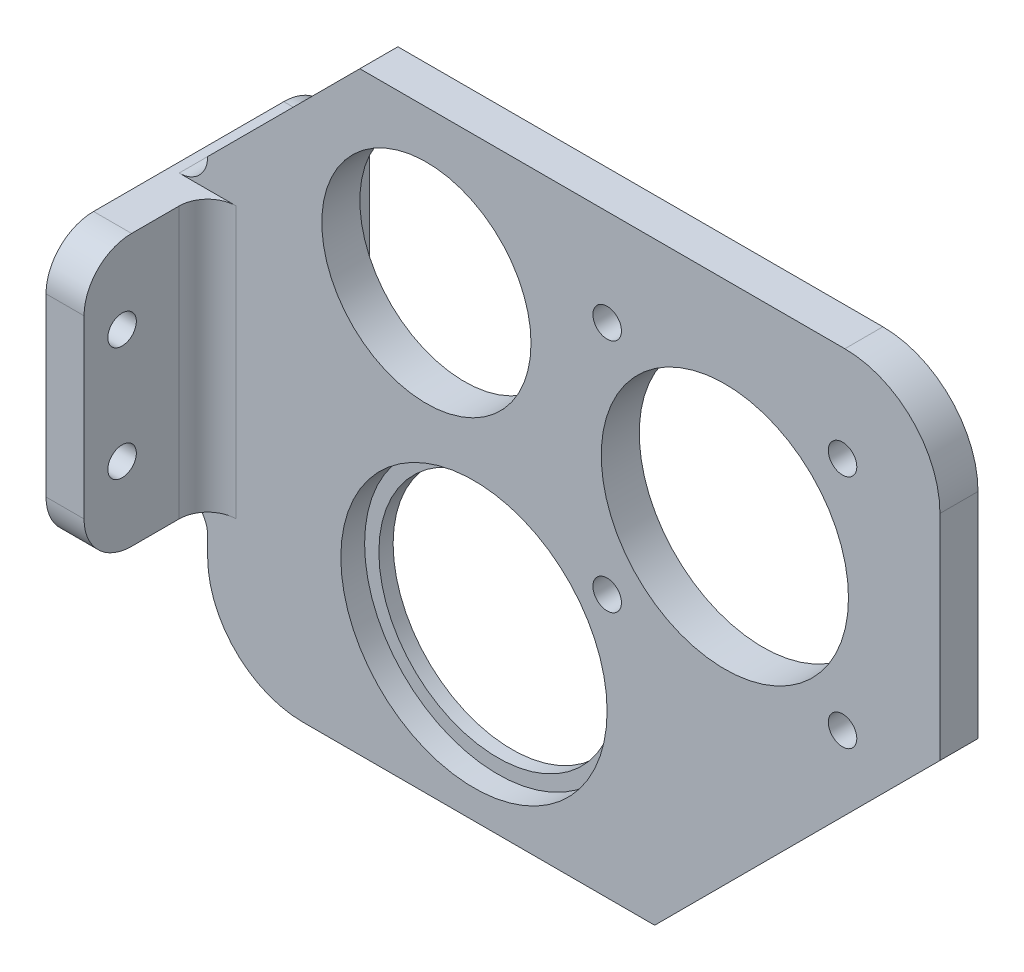
from build123d import *

# Parameters (mm, degrees)
SKETCH_1_W           = 77
SKETCH_1_H           = 62.5
SKETCH_1_R           = 14
SKETCH_1_R_2         = 13
EXTRUDE_1_DEPTH      = 4
EXTRUDE_2_DEPTH      = 17
EXTRUDE_2_DEPTH_BACK = 13
FILLET_1_R           = 3
SKETCH_4_W           = 20
SKETCH_4_H           = 28.5
CUT_EXTRUDE_3_DEPTH  = 74
SKETCH_9_R           = 1.5
CUT_EXTRUDE_6_DEPTH  = 10
SKETCH_10_R          = 1.5
CUT_EXTRUDE_7_DEPTH  = 10
FILLET_2_R           = 5
CUT_EXTRUDE_8_DEPTH  = 10
FILLET_3_R           = 10
FILLET_4_R           = 3
SKETCH_13_R          = 14
SKETCH_13_R_2        = 12.5
EXTRUDE_3_DEPTH      = 1.5
SKETCH_14_R          = 11
CUT_EXTRUDE_9_DEPTH  = 10


with BuildPart() as part:
    # 草图1 → 凸台-拉伸1 (new body)
    with BuildSketch(Plane.XY):
        with Locations((10.5, 14.25)):
            Rectangle(SKETCH_1_W, SKETCH_1_H)
        Circle(SKETCH_1_R, mode=Mode.SUBTRACT)
        with Locations((26.381811917, 23)):
            Circle(SKETCH_1_R_2, mode=Mode.SUBTRACT)
    extrude(amount=EXTRUDE_1_DEPTH)

    # 草图1<3> → 凸台-拉伸2 (add, two sides: drawn at the far end of the back side and taken through both)
    with BuildSketch(Plane.XY.offset(-EXTRUDE_2_DEPTH_BACK)):
        Polygon((-52, 22.5), (-52, 26.5), (-28, 26.5), (-28, -2), (-52, -2), (-52, 2), (-32, 2), (-32, 22.5), align=None)
    extrude(amount=EXTRUDE_2_DEPTH + EXTRUDE_2_DEPTH_BACK)

    # 圆角1
    fillet_1_edges = [part.edges().sort_by_distance(p)[0] for p in [
        (-28, 12.25, 0),
        (-28, 12.25, 4),
    ]]
    fillet(fillet_1_edges, radius=FILLET_1_R)

    # 草图4 → 切除-拉伸3 (cut)
    with BuildSketch(Plane.XY.offset(17)):
        with Locations((-42, 12.25)):
            Rectangle(SKETCH_4_W, SKETCH_4_H)
    extrude(amount=-CUT_EXTRUDE_3_DEPTH, mode=Mode.SUBTRACT)

    # 草图9 → 切除-拉伸6 (cut)
    with BuildSketch(Plane.XY.offset(4)):
        with Locations((38.756180587, 35.374368671)):
            Circle(SKETCH_9_R)
        with Locations((38.756180587, 10.625631329)):
            Circle(SKETCH_9_R)
        with Locations((14.007443246, 10.625631329)):
            Circle(SKETCH_9_R)
        with Locations((14.007443246, 35.374368671)):
            Circle(SKETCH_9_R)
    extrude(amount=-CUT_EXTRUDE_6_DEPTH, mode=Mode.SUBTRACT)

    # 草图10 → 切除-拉伸7 (cut)
    with BuildSketch(Plane(origin=(-28, 0, 0), x_dir=(0, 0, -1), z_dir=(1, 0, 0))):
        with Locations((-13, 18.25)):
            Circle(SKETCH_10_R)
        with Locations((-13, 6.25)):
            Circle(SKETCH_10_R)
        with Locations((9, 18.25)):
            Circle(SKETCH_10_R)
        with Locations((9, 6.25)):
            Circle(SKETCH_10_R)
    extrude(amount=-CUT_EXTRUDE_7_DEPTH, mode=Mode.SUBTRACT)

    # 圆角2
    fillet_2_edges = [part.edges().sort_by_distance(p)[0] for p in [
        (-30, -2, 17),
        (-30, -2, -13),
        (-30, 26.5, 17),
        (-30, 26.5, -13),
    ]]
    fillet(fillet_2_edges, radius=FILLET_2_R)

    # 草图11 → 切除-拉伸8 (cut)
    with BuildSketch(Plane.XY.offset(4)):
        Polygon((-28, 29.5), (-28, 45.5), (-12, 45.5), align=None)
        Polygon((19, -17), (49, 13), (49, -17), align=None)
    extrude(amount=-CUT_EXTRUDE_8_DEPTH, mode=Mode.SUBTRACT)

    # 圆角3
    fillet_3_edges = [part.edges().sort_by_distance(p)[0] for p in [
        (-28, -17, 2),
        (49, 45.5, 2),
    ]]
    fillet(fillet_3_edges, radius=FILLET_3_R)

    # 圆角4
    fillet_4_edges = [part.edges().sort_by_distance(p)[0] for p in [
        (-28, -2, 2),
        (-28, 26.5, 2),
    ]]
    fillet(fillet_4_edges, radius=FILLET_4_R - 0.0001)  # a hair under: the kernel refuses the full size

    # 草图13 → 凸台-拉伸3 (add)
    with BuildSketch(Plane(origin=(0, 0, 0), x_dir=(-1, 0, 0), z_dir=(0, 0, -1))):
        Circle(SKETCH_13_R)
        Circle(SKETCH_13_R_2, mode=Mode.SUBTRACT)
    extrude(amount=-EXTRUDE_3_DEPTH)

    # 草图14 → 切除-拉伸9 (cut)
    with BuildSketch(Plane.XY.offset(4)):
        with Locations((-5, 29.5)):
            Circle(SKETCH_14_R)
    extrude(amount=-CUT_EXTRUDE_9_DEPTH, mode=Mode.SUBTRACT)


solid = part.part
